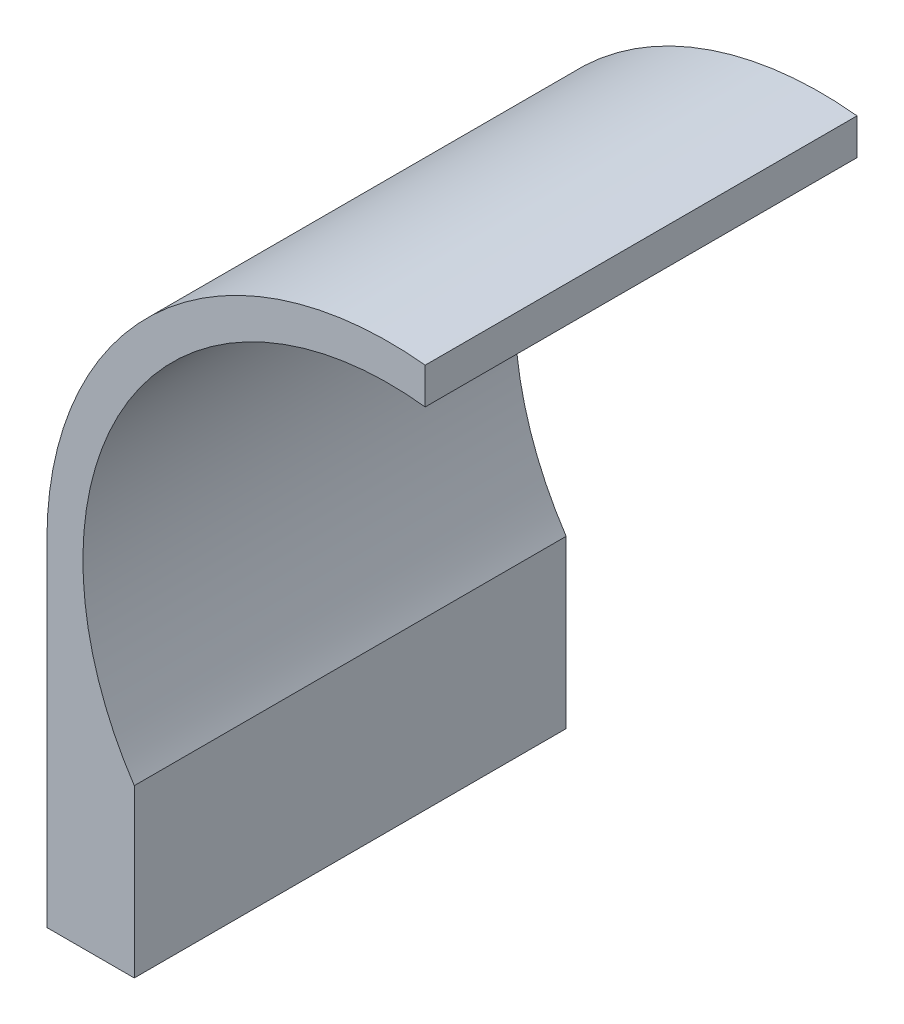
from build123d import *

# Parameters (mm, degrees)
INNER_RING_LEFT_SIDE_DEPTH = 120


with BuildPart() as part:
    # Sketch1 → Inner Ring - Left Side (new body)
    with BuildSketch(Plane.XY):
        with BuildLine():
            Line((-70.731226598, -47.139087644), (-70.731226598, -63.419977798))
            Line((-70.731226598, -63.419977798), (-70.731226598, -93.419977798))
            Line((-70.731226598, -93.419977798), (-95, -93.419977798))
            Line((-95, -93.419977798), (-95, 0))
            ThreePointArc((-95, 0), (-63.503936886, 70.655856091), (10.1, 94.461579491))
            Line((10.1, 94.461579491), (10.1, 84.397808028))
            ThreePointArc((10.1, 84.397808028), (-72.419093756, 44.50252644), (-70.731226598, -47.139087644))
        make_face()
    extrude(amount=INNER_RING_LEFT_SIDE_DEPTH)


solid = part.part
